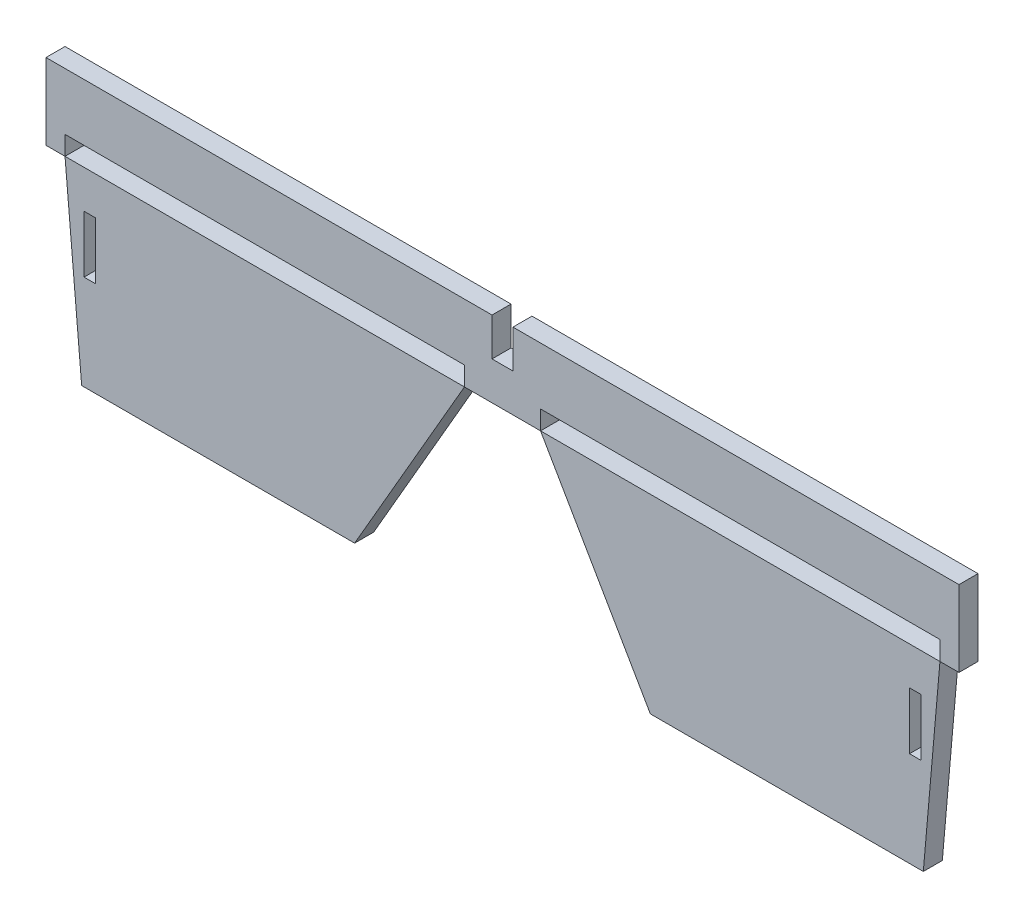
from build123d import *

# Parameters (mm, degrees)
SKETCH1_W             = 3
SKETCH1_H             = 15
BOSS_EXTRUDE2_DEPTH   = 2.5
BOSS_EXTRUDE2_2_DEPTH = 2.5
MIRROR1_START         = -2.5
MIRROR1_DEPTH         = 5


# Read off the part's stored shape, not the designer's step: Mirror1
with BuildPart() as part:
    # Sketch1 → Boss-Extrude2 (new, symmetric)
    with BuildSketch(Plane.XY):
        Polygon((-10, -10), (-115, -10), (-110.625566824, -60), (-38.867513459, -60), align=None)
        with Locations((-108.5, -27.5)):
            Rectangle(SKETCH1_W, SKETCH1_H, mode=Mode.SUBTRACT)
    extrude(amount=BOSS_EXTRUDE2_DEPTH, both=True)


with BuildPart() as body_2:
    # Sketch1 → Boss-Extrude2 2 (new, symmetric)
    with BuildSketch(Plane.XY):
        Polygon((-120, -10), (-115, -10), (-115, -5), (-10, -5), (-10, -10), (0, -10), (0, 0), (-2.75, 0), (-2.75, 10), (-120, 10), align=None)
    extrude(amount=BOSS_EXTRUDE2_2_DEPTH, both=True)

    # Mirror1 outline → Mirror1 (add)
    with BuildSketch(Plane.XY.offset(MIRROR1_START)):
        Polygon((0, -10), (10, -10), (10, -5), (115, -5), (115, -10), (120, -10), (120, 10), (2.75, 10), (2.75, 0), (0, 0), align=None)
    extrude(amount=MIRROR1_DEPTH)


with BuildPart() as body_3:
    # Mirror3: mirrored copy
    add(part.part.mirror(Plane(origin=(0, 0, 0), x_dir=(0, 0, 1), z_dir=(1, 0, 0))))


solid = Compound([part.part, body_2.part, body_3.part])
